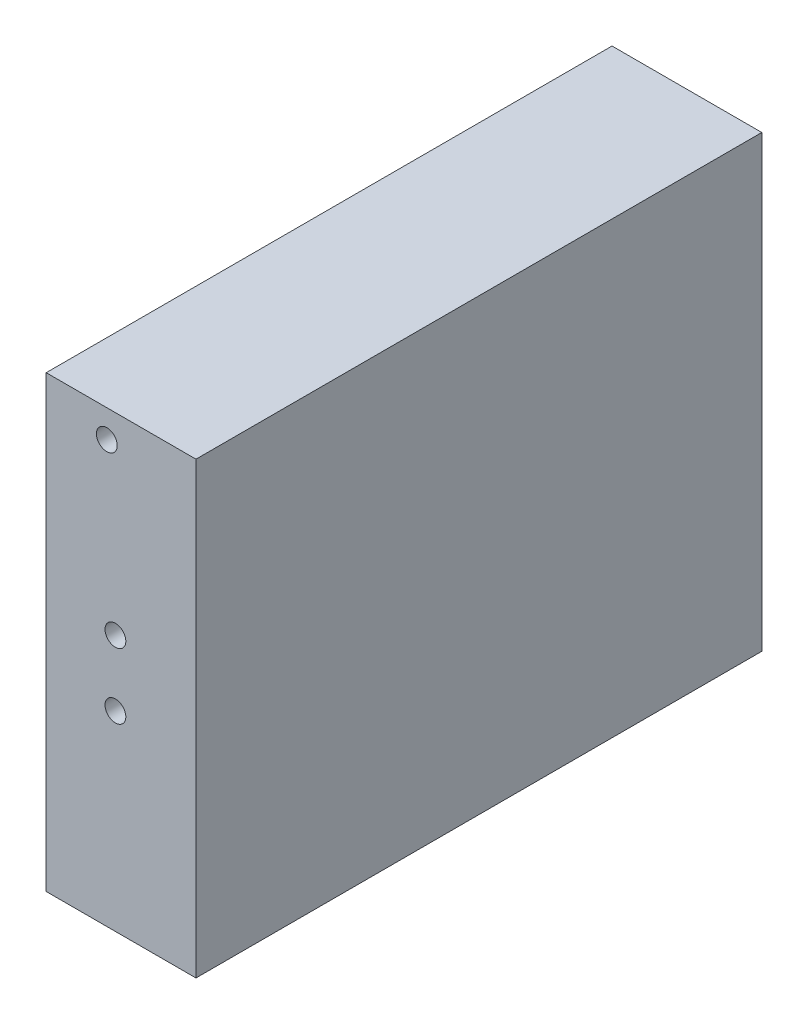
from build123d import *

# Parameters (mm, degrees)
SKETCH1_W           = 57.15
SKETCH1_H           = 171.45
BOSS_EXTRUDE1_DEPTH = 215.9
SKETCH2_R           = 3.175
CUT_EXTRUDE1_DEPTH  = 46.7399878
SKETCH3_R           = 3.96875
CUT_EXTRUDE2_DEPTH  = 13.0400044
SKETCH4_R           = 3.175
CUT_EXTRUDE3_DEPTH  = 35.1600008
SKETCH5_R           = 3.175
CUT_EXTRUDE4_DEPTH  = 94.6600088
SKETCH6_R           = 3.96875
CUT_EXTRUDE5_DEPTH  = 10.16
SKETCH7_R           = 3.96875
CUT_EXTRUDE6_DEPTH  = 69.660008


with BuildPart() as part:
    # Sketch1 → Boss-Extrude1 (new body)
    with BuildSketch(Plane.XY):
        with Locations((28.575, 85.725)):
            Rectangle(SKETCH1_W, SKETCH1_H)
    extrude(amount=BOSS_EXTRUDE1_DEPTH)

    # Sketch2 → Cut-Extrude1 (cut)
    with BuildSketch(Plane(origin=(0, 0, 0), x_dir=(-1, 0, 0), z_dir=(0, 0, -1))):
        with Locations((-24.41, 70.569)):
            Circle(SKETCH2_R)
    extrude(amount=-CUT_EXTRUDE1_DEPTH, mode=Mode.SUBTRACT)

    # Sketch3 → Cut-Extrude2 (cut)
    with BuildSketch(Plane(origin=(0, 0, 0), x_dir=(-1, 0, 0), z_dir=(0, 0, -1))):
        with Locations((-24.41, 70.569)):
            Circle(SKETCH3_R)
    extrude(amount=-CUT_EXTRUDE2_DEPTH, mode=Mode.SUBTRACT)

    # Sketch4 → Cut-Extrude3 (cut)
    with BuildSketch(Plane.XY.offset(215.9)):
        with Locations((26.41, 73.569)):
            Circle(SKETCH4_R)
        with Locations((26.41, 98.569)):
            Circle(SKETCH4_R)
    extrude(amount=-CUT_EXTRUDE3_DEPTH, mode=Mode.SUBTRACT)

    # Sketch5 → Cut-Extrude4 (cut)
    with BuildSketch(Plane.XY.offset(215.9)):
        with Locations((23.13, 10.569)):
            Circle(SKETCH5_R)
    extrude(amount=-CUT_EXTRUDE4_DEPTH, mode=Mode.SUBTRACT)

    # Sketch6 → Cut-Extrude5 (cut)
    with BuildSketch(Plane.XY.offset(215.9)):
        with Locations((26.41, 73.569)):
            Circle(SKETCH6_R)
        with Locations((26.41, 98.569)):
            Circle(SKETCH6_R)
    extrude(amount=-CUT_EXTRUDE5_DEPTH, mode=Mode.SUBTRACT)

    # Sketch7 → Cut-Extrude6 (cut)
    with BuildSketch(Plane.XY.offset(215.9)):
        with Locations((23.13, 10.569)):
            Circle(SKETCH7_R)
    extrude(amount=-CUT_EXTRUDE6_DEPTH, mode=Mode.SUBTRACT)


with BuildPart() as body_2:
    # Mirror1: mirrored copy
    add(part.part.mirror(Plane(origin=(0, 0, 215.9), x_dir=(0, 0, 1), z_dir=(0, 1, 0))))


solid = body_2.part
